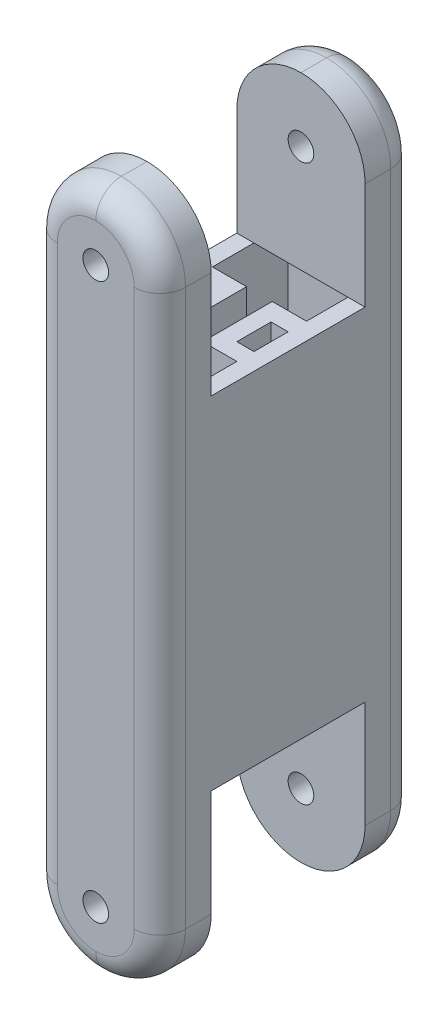
from build123d import *

# Parameters (mm, degrees)
BOSS_EXTRUDE1_START  = -20
SKETCH1_W            = 15
SKETCH1_H            = 30
SKETCH1_W_2          = 2
SKETCH1_H_2          = 4.496327887
SKETCH1_H_3          = 4
BOSS_EXTRUDE1_DEPTH  = 40
SKETCH2_W            = 15
SKETCH2_H            = 6
BOSS_EXTRUDE2_DEPTH  = 20
FILLET1_R            = 7.5
SKETCH3_R            = 1.5
CUT_EXTRUDE1_DEPTH   = 51.55937104
FILLET1_OF_MIRROR1_R = 7.5
FILLET4_R            = 3


with BuildPart() as part:
    # Sketch1 → Boss-Extrude1 (new body)
    with BuildSketch(Plane(origin=(0, 0, 0), x_dir=(1, 0, 0), z_dir=(0, 1, 0)).offset(BOSS_EXTRUDE1_START)):
        Rectangle(SKETCH1_W, SKETCH1_H)
        Polygon((-5.5, -13), (5.5, -13), (5.5, -4), (1.5, -4), (1.5, 4.144450542), (5.5, 4.144450542), (5.5, 13), (-5.5, 13), (-5.5, 4.144450542), (-1.5, 4.144450542), (-1.5, -4.208461458), (-5.5, -4.208461458), align=None, mode=Mode.SUBTRACT)
        with Locations((-4.5, -0.248163944)):
            Rectangle(SKETCH1_W_2, SKETCH1_H_2, mode=Mode.SUBTRACT)
        with Locations((4.5, 0)):
            Rectangle(SKETCH1_W_2, SKETCH1_H_3, mode=Mode.SUBTRACT)
    extrude(amount=BOSS_EXTRUDE1_DEPTH)

    # Sketch2 → Boss-Extrude2 (add)
    with BuildSketch(Plane.XZ.offset(20)):
        with Locations((0, 12)):
            Rectangle(SKETCH2_W, SKETCH2_H)
        with Locations((0, -12)):
            Rectangle(SKETCH2_W, SKETCH2_H)
    boss_extrude2 = extrude(amount=BOSS_EXTRUDE2_DEPTH)

    # Fillet1
    fillet1_edges = [part.edges().sort_by_distance(p)[0] for p in [
        (-7.5, -40, 12),
        (-7.5, -40, -12),
        (7.5, -40, -12),
        (7.5, -40, 12),
    ]]
    fillet(fillet1_edges, radius=FILLET1_R - 0.0001)  # a hair under: the kernel refuses the full size

    # Sketch3 → Cut-Extrude1 (cut, through all)
    with BuildSketch(Plane.XY.offset(15)):
        with Locations((0, -32.5)):
            Circle(SKETCH3_R)
    cut_extrude1 = extrude(amount=-CUT_EXTRUDE1_DEPTH, mode=Mode.SUBTRACT)

    # Mirror1: Boss-Extrude2, Cut-Extrude1 across plane
    add(boss_extrude2.mirror(Plane.ZX))
    add(cut_extrude1.mirror(Plane.ZX), mode=Mode.SUBTRACT)

    # Fillet1 of Mirror1
    fillet1_of_mirror1_edges = [part.edges().sort_by_distance(p)[0] for p in [
        (-7.5, 40, 12),
        (-7.5, 40, -12),
        (7.5, 40, -12),
        (7.5, 40, 12),
    ]]
    fillet(fillet1_of_mirror1_edges, radius=FILLET1_OF_MIRROR1_R - 0.0001)  # a hair under: the kernel refuses the full size

    # Fillet4
    fillet4_edges = [part.edges().sort_by_distance(p)[0] for p in [
        (5.303330148, -37.803330148, 15),
        (-5.303330148, -37.803330148, 15),
        (5.303330148, -37.803330148, -15),
        (-5.303330148, -37.803330148, -15),
        (-7.5, 0, 15),
        (-7.5, 0, -15),
        (7.5, 0, 15),
        (5.303330148, 37.803330148, 15),
        (-5.303330148, 37.803330148, 15),
        (7.5, 0, -15),
        (5.303330148, 37.803330148, -15),
        (-5.303330148, 37.803330148, -15),
    ]]
    fillet(fillet4_edges, radius=FILLET4_R)


solid = part.part
